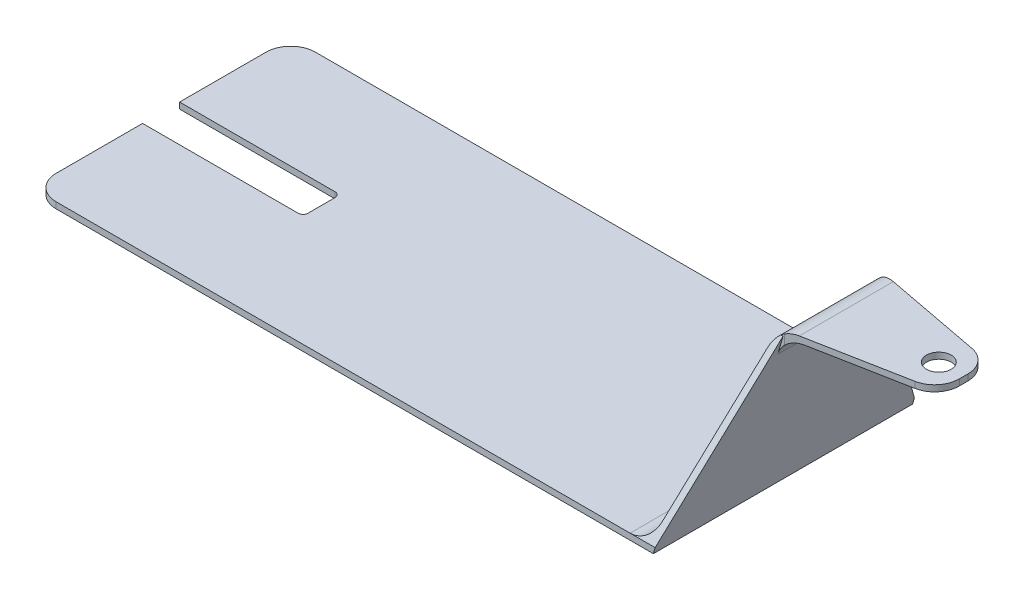
from build123d import *

# Parameters (mm, degrees)
BOSS_EXTRUDE1_DEPTH = 105
CUT_EXTRUDE1_REACH  = 238.485
SKETCH2_W           = 65
SKETCH2_H           = 15
CUT_EXTRUDE12_DEPTH = 281.35970199
CUT_EXTRUDE14_REACH = 239.237
FILLET1_R           = 10
FILLET2_R           = 10
FILLET3_R           = 10
FILLET4_R           = 2
CUT_EXTRUDE15_REACH = 239.237
SKETCH13_R          = 5
FILLET5_R           = 10


with BuildPart() as part:
    # Sketch1 → Boss-Extrude1 (new body)
    with BuildSketch(Plane.XY):
        Polygon((-125, -1.25), (125, -1.25), (126.885753532, -1.25), (146.885753532, 68.75), (200, 68.75), (200, 71.25), (145, 71.25), (125, 1.25), (-125, 1.25), align=None)
    extrude(amount=BOSS_EXTRUDE1_DEPTH)

    # Sketch2 → Cut-Extrude1 (cut, up to next)
    with BuildSketch(Plane(origin=(0, 1.25, 0), x_dir=(1, 0, 0), z_dir=(0, 1, 0)), mode=Mode.PRIVATE) as cut_extrude1_sk1:
        with Locations((-92.5, -52.5)):
            Rectangle(SKETCH2_W, SKETCH2_H)
    cut_extrude1_tool1 = extrude(cut_extrude1_sk1.sketch, amount=-CUT_EXTRUDE1_REACH, mode=Mode.PRIVATE) & part.part
    add(cut_extrude1_tool1.solids().sort_by_distance((-92.5, 1.25, 52.5))[0], mode=Mode.SUBTRACT)

    # Sketch11 → Cut-Extrude12 (cut, through all)
    with BuildSketch(Plane(origin=(125, 0, 0), x_dir=(0, 0, -1), z_dir=(1, 0, 0))):
        Polygon((0, 71.25), (0, 1.25), (-32.5, 68.75), (-32.5, 71.25), align=None)
        Polygon((-72.5, 68.75), (-72.5, 71.25), (-105, 71.25), (-105, 1.25), align=None)
    extrude(amount=CUT_EXTRUDE12_DEPTH, mode=Mode.SUBTRACT)

    # Sketch12 → Cut-Extrude14 (cut, up to next)
    with BuildSketch(Plane(origin=(0, 71.25, 0), x_dir=(1, 0, 0), z_dir=(0, 1, 0)), mode=Mode.PRIVATE) as cut_extrude14_sk1:
        Polygon((200, -62.5), (147.5, -72.5), (200, -72.5), align=None)
    cut_extrude14_tool1 = extrude(cut_extrude14_sk1.sketch, amount=-CUT_EXTRUDE14_REACH, mode=Mode.PRIVATE) & part.part
    # Sketch12 → Cut-Extrude14 (cut, up to next)
    with BuildSketch(Plane(origin=(0, 71.25, 0), x_dir=(1, 0, 0), z_dir=(0, 1, 0)), mode=Mode.PRIVATE) as cut_extrude14_sk2:
        Polygon((200, -32.5), (147.5, -32.5), (200, -42.5), align=None)
    cut_extrude14_tool2 = extrude(cut_extrude14_sk2.sketch, amount=-CUT_EXTRUDE14_REACH, mode=Mode.PRIVATE) & part.part
    add(cut_extrude14_tool1.solids().sort_by_distance((182.5, 71.25, 69.166667))[0], mode=Mode.SUBTRACT)
    add(cut_extrude14_tool2.solids().sort_by_distance((182.5, 71.25, 35.833333))[0], mode=Mode.SUBTRACT)

    # Fillet1
    fillet1_edges = [part.edges().sort_by_distance(p)[0] for p in [
        (200, 70, 42.5),
        (200, 70, 62.5),
    ]]
    fillet(fillet1_edges, radius=FILLET1_R)

    # Fillet2
    # the kernel refuses this fillet: 10 mm, written as the material it adds along each edge
    with BuildSketch(Plane(origin=(146.885753532, 68.75, 32.5), x_dir=(1, 0, 0), z_dir=(0, 0, 1))) as fillet2_piece_1_section:
        with BuildLine():
            CenterArc((FILLET2_R * 0.754301412754, -FILLET2_R), FILLET2_R, 90, 74.054604099)
            Line((-FILLET2_R * 0.207222534886, -FILLET2_R * 0.725278872103), (0, 0))
            Line((0, 0), (FILLET2_R * 0.754301412754, 0))
        make_face()
    fillet2_piece_1 = extrude(amount=40, mode=Mode.PRIVATE)
    fillet2_piece_1 = split(fillet2_piece_1, bisect_by=Plane(origin=(151.701250416, 67.179105295, 33.300238174), z_dir=(-0.18711210788999527, 0, 0.9823385664224747)), keep=Keep.TOP, mode=Mode.PRIVATE)
    fillet2_piece_1 = split(fillet2_piece_1, bisect_by=Plane(origin=(151.701250416, 67.179105295, 71.699761826), z_dir=(-0.18711210788999538, 0, -0.9823385664224747)), keep=Keep.TOP, mode=Mode.PRIVATE)
    add(fillet2_piece_1)
    # the kernel refuses this fillet: 10 mm, written as the material it takes off along each edge
    with BuildSketch(Plane(origin=(145, 71.25, 13.642464681), x_dir=(-0.27472112789737757, -0.9615239476408233, 0), z_dir=(0, 0, 1))) as fillet2_2_piece_1:
        with BuildLine():
            CenterArc((FILLET2_R * 0.754301412754, FILLET2_R), FILLET2_R, 195.945395901, 74.054604099)
            Line((-FILLET2_R * 0.207222534886, FILLET2_R * 0.725278872103), (0, 0))
            Line((0, 0), (FILLET2_R * 0.754301412754, 0))
        make_face()
    extrude(amount=77.715070638, mode=Mode.SUBTRACT)

    # Fillet3
    fillet3_edges = [part.edges().sort_by_distance(p)[0] for p in [
        (125, 1.25, 52.5),
    ]]
    fillet(fillet3_edges, radius=FILLET3_R)

    # Fillet4
    fillet4_edges = [part.edges().sort_by_distance(p)[0] for p in [
        (-60, 0, 45),
        (-60, 0, 60),
    ]]
    fillet(fillet4_edges, radius=FILLET4_R)

    # Sketch13 → Cut-Extrude15 (cut, up to next)
    with BuildSketch(Plane(origin=(0, 71.25, 0), x_dir=(1, 0, 0), z_dir=(0, 1, 0)), mode=Mode.PRIVATE) as cut_extrude15_sk1:
        with Locations(Location((190, -52.5, 0), (0, 0, 270))):
            Circle(SKETCH13_R)
    cut_extrude15_tool1 = extrude(cut_extrude15_sk1.sketch, amount=-CUT_EXTRUDE15_REACH, mode=Mode.PRIVATE) & part.part
    add(cut_extrude15_tool1.solids().sort_by_distance((190, 71.25, 52.5))[0], mode=Mode.SUBTRACT)

    # Fillet5
    fillet5_edges = [part.edges().sort_by_distance(p)[0] for p in [
        (-125, 0, 0),
        (-125, 0, 105),
    ]]
    fillet(fillet5_edges, radius=FILLET5_R)


solid = part.part
